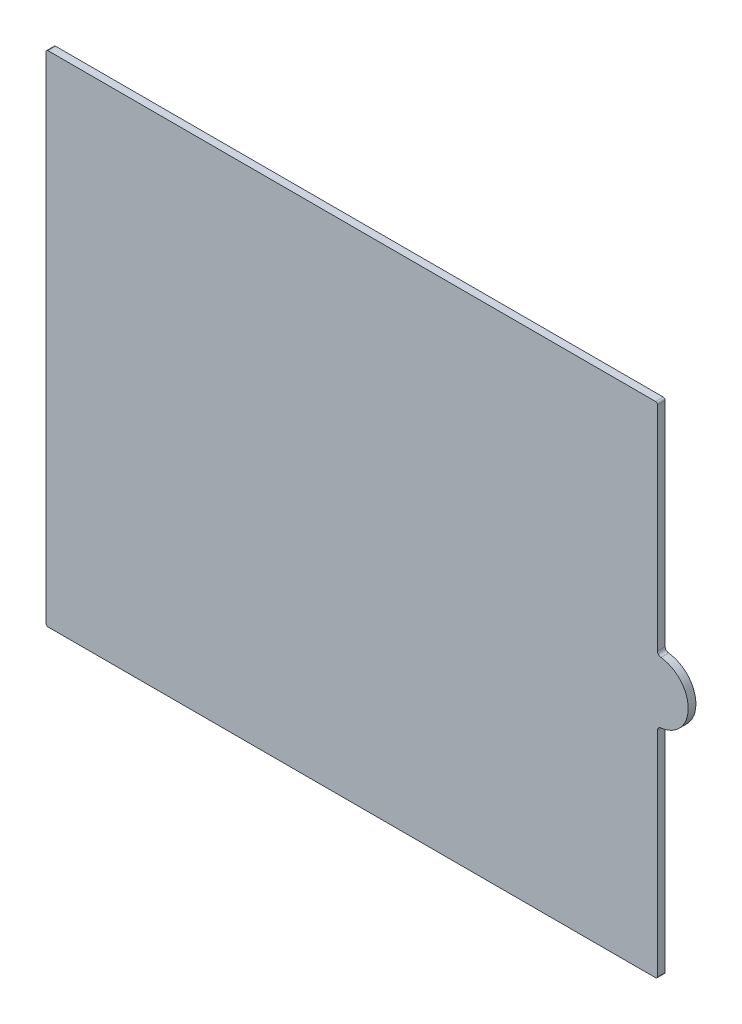
from build123d import *

# Parameters (mm, degrees)
BOSS_EXTRUDE1_DEPTH = 3.175
FILLET1_R           = 0.79375
FILLET2_R           = 1.5875


# Read off the part's stored shape, not the designer's step: Boss-Extrude1
with BuildPart() as part:
    # Boss-Extrude1 outline → Boss-Extrude1 (new body)
    with BuildSketch(Plane.XY):
        with BuildLine():
            ThreePointArc((252.73, 90.4494), (265.43, 103.1494), (252.73, 115.8494))
            Line((252.73, 115.8494), (252.73, 206.2988))
            Line((252.73, 206.2988), (0, 206.2988))
            Line((0, 206.2988), (0, 0))
            Line((0, 0), (252.73, 0))
            Line((252.73, 0), (252.73, 90.4494))
        make_face()
    extrude(amount=BOSS_EXTRUDE1_DEPTH)

    # Fillet1
    fillet1_edges = [part.edges().sort_by_distance(p)[0] for p in [
        (252.73, 0, 1.5875),
        (0, 0, 1.5875),
        (0, 206.2988, 1.5875),
        (252.73, 206.2988, 1.5875),
    ]]
    fillet(fillet1_edges, radius=FILLET1_R)

    # Fillet2
    fillet2_edges = [part.edges().sort_by_distance(p)[0] for p in [
        (252.73, 90.4494, 1.5875),
        (252.73, 115.8494, 1.5875),
    ]]
    fillet(fillet2_edges, radius=FILLET2_R)


solid = part.part
